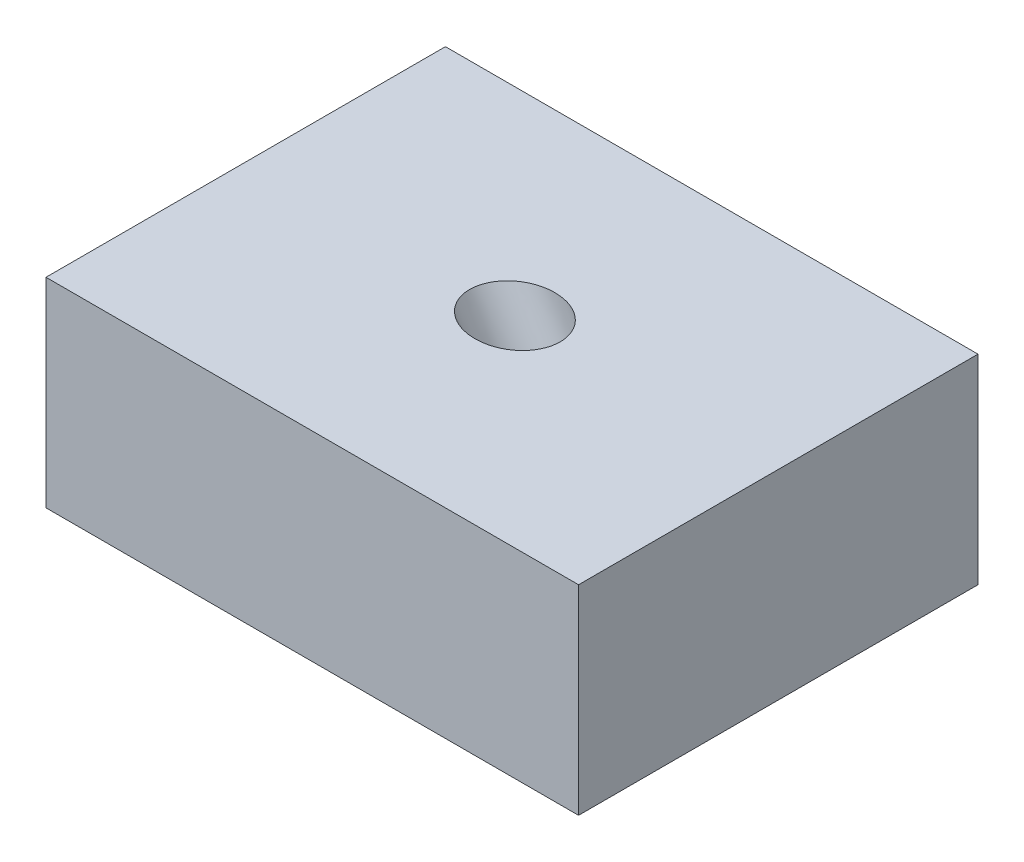
from build123d import *

# Parameters (mm, degrees)
SKETCH1_W           = 80
SKETCH1_H           = 60
BOSS_EXTRUDE1_DEPTH = 30
SKETCH6_W           = 80
SKETCH6_H           = 60
SKETCH6_W_2         = 70
SKETCH6_H_2         = 50
BOSS_EXTRUDE2_DEPTH = 6
SKETCH11_W          = 80
SKETCH11_H          = 60
BOSS_EXTRUDE3_DEPTH = 30
CUT_EXTRUDE6_START  = -71.221899132
CUT_EXTRUDE6_DEPTH  = 84.428953332


# Read off the part's stored shape, not the designer's step: Cut-Extrude6
with BuildPart() as part:
    # Sketch1 → Boss-Extrude1 (new body)
    with BuildSketch(Plane(origin=(0, 0, 0), x_dir=(1, 0, 0), z_dir=(0, 1, 0))):
        Rectangle(SKETCH1_W, SKETCH1_H)
    extrude(amount=BOSS_EXTRUDE1_DEPTH)


with BuildPart() as body_2:
    # Sketch6 → Boss-Extrude2 (new body)
    with BuildSketch(Plane(origin=(0, 30, 0), x_dir=(1, 0, 0), z_dir=(0, 1, 0))):
        Rectangle(SKETCH6_W, SKETCH6_H)
        Rectangle(SKETCH6_W_2, SKETCH6_H_2, mode=Mode.SUBTRACT)
    extrude(amount=BOSS_EXTRUDE2_DEPTH)


with BuildPart() as body_3:
    # Sketch11 → Boss-Extrude3 (new body)
    with BuildSketch(Plane(origin=(0, 36, 0), x_dir=(1, 0, 0), z_dir=(0, 1, 0))):
        Rectangle(SKETCH11_W, SKETCH11_H)
    extrude(amount=BOSS_EXTRUDE3_DEPTH)


with BuildPart() as cut_extrude6_tool:
    # Cut-Extrude6 outline → Cut-Extrude6 (new body)
    with BuildSketch(Plane(origin=(0, 0, 0), x_dir=(0.853483816047575, 0.521119348849061, 0), z_dir=(0.521119348849061, -0.8534838160475748, 0)).offset(CUT_EXTRUDE6_START)):
        with BuildLine():
            add(Edge.make_bspline(
                [(21.630374994, -0.221368563), (21.630374994, 10.170936282), (12.910570075, 4.974783859), (4.190765156, -0.221368563), (12.910570075, -5.417520986), (21.630374994, -10.613673409), (21.630374994, -0.221368563)],
                knots=[0, 0, 0, 2.094395102, 2.094395102, 4.188790205, 4.188790205, 6.283185307, 6.283185307, 6.283185307], degree=2, weights=[1, 0.5, 1, 0.5, 1, 0.5, 1]))
        make_face()
    extrude(amount=CUT_EXTRUDE6_DEPTH)


with BuildPart() as part_1:
    add(part.part)

    # Cut-Extrude6: cut by cut_extrude6_tool
    add(cut_extrude6_tool.part, mode=Mode.SUBTRACT)


with BuildPart() as body_3_1:
    add(body_3.part)

    # Cut-Extrude6: cut by cut_extrude6_tool
    add(cut_extrude6_tool.part, mode=Mode.SUBTRACT)


solid = part_1.part
